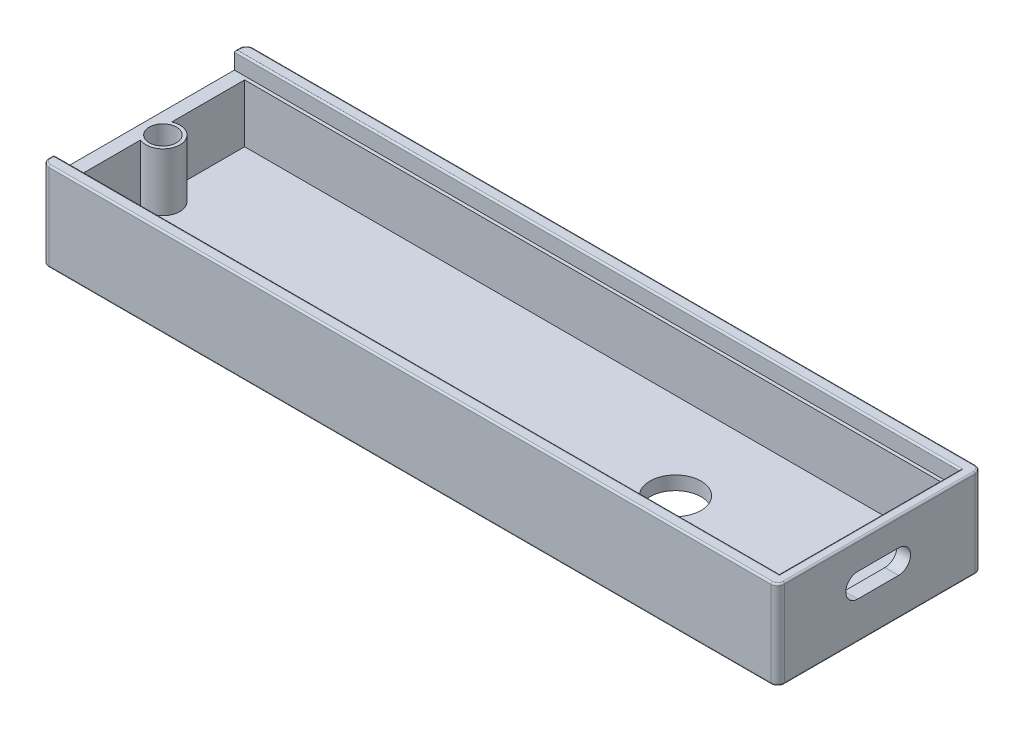
from build123d import *

# Parameters (mm, degrees)
SKETCH1_W                      = 108
SKETCH1_H                      = 30
BOSS_EXTRUDE1_DEPTH            = 13
SKETCH2_W                      = 106.5
SKETCH2_H                      = 26.5
CUT_EXTRUDE1_DEPTH             = 2.5
SKETCH3_W                      = 104
SKETCH3_H                      = 25.5
CUT_EXTRUDE2_DEPTH             = 11
FILLET1_R                      = 0.25
FILLET2_R                      = 1
SKETCH4_R                      = 2.5
BOSS_EXTRUDE2_DEPTH            = 8.5
F_2_2_2_2_DIAMETER_HOLE1_D     = 2.2
F_2_2_2_2_DIAMETER_HOLE1_DEPTH = 7
F_2_2_2_2_DIAMETER_HOLE1_TIP   = 0.660946681
THREAD1_PITCH                  = 0.4
CUT_EXTRUDE3_REACH             = 114.841
SKETCH11_W                     = 26.5
SKETCH11_H                     = 1.125
CUT_EXTRUDE4_DEPTH             = 1
SKETCH13_R                     = 3.75
CUT_EXTRUDE5_DEPTH             = 113.627705322
SKETCH18_R                     = 2
CUT_EXTRUDE7_DEPTH             = 4


with BuildPart() as part:
    # Sketch1 → Boss-Extrude1 (new body)
    with BuildSketch(Plane(origin=(0, 0, 0), x_dir=(1, 0, 0), z_dir=(0, 1, 0))):
        with Locations((54, -15)):
            Rectangle(SKETCH1_W, SKETCH1_H)
    extrude(amount=-BOSS_EXTRUDE1_DEPTH)

    # Sketch2 → Cut-Extrude1 (cut)
    with BuildSketch(Plane(origin=(0, 0, 0), x_dir=(1, 0, 0), z_dir=(0, 1, 0))):
        with Locations((53.25, -15)):
            Rectangle(SKETCH2_W, SKETCH2_H)
    extrude(amount=-CUT_EXTRUDE1_DEPTH, mode=Mode.SUBTRACT)

    # Sketch3 → Cut-Extrude2 (cut)
    with BuildSketch(Plane(origin=(0, 0, 0), x_dir=(1, 0, 0), z_dir=(0, 1, 0))):
        with Locations((54, -15)):
            Rectangle(SKETCH3_W, SKETCH3_H)
    extrude(amount=-CUT_EXTRUDE2_DEPTH, mode=Mode.SUBTRACT)

    # Fillet1
    fillet1_edges = [part.edges().sort_by_distance(p)[0] for p in [
        (108, -13, 15),
        (0, 0, 29.125),
        (54, -13, 0),
        (53.25, 0, 28.25),
        (106.5, 0, 15),
        (53.25, 0, 1.75),
        (0, -13, 15),
        (54, 0, 0),
        (108, 0, 15),
        (54, 0, 30),
        (0, 0, 0.875),
        (54, -13, 30),
    ]]
    fillet(fillet1_edges, radius=FILLET1_R)

    # Fillet2
    # the kernel refuses this fillet: 1 mm, written as the material it takes off along each edge
    with BuildSketch(Plane(origin=(1, -13, 1), x_dir=(-1, 0, 0), z_dir=(0, 0, 1))) as fillet2_piece_1:
        with BuildLine():
            CenterArc((0.75, -0.25), 0.25, 0, 90)
            Line((1, -0.25), (1, 0))
            Line((1, 0), (0.75, 0))
        make_face()
    revolve(axis=Axis((1, -13, 1), (0, -1, 0)), revolution_arc=90, mode=Mode.SUBTRACT)
    with BuildSketch(Plane(origin=(107, -13, 1), x_dir=(0, 0, -1), z_dir=(-1, 0, 0))) as fillet2_piece_2:
        with BuildLine():
            CenterArc((0.75, -0.25), 0.25, 0, 90)
            Line((1, -0.25), (1, 0))
            Line((1, 0), (0.75, 0))
        make_face()
    revolve(axis=Axis((107, -13, 1), (0, -1, 0)), revolution_arc=90, mode=Mode.SUBTRACT)
    with BuildSketch(Plane(origin=(1, -13, 29), x_dir=(0, 0, 1), z_dir=(1, 0, 0))) as fillet2_piece_3:
        with BuildLine():
            CenterArc((0.75, -0.25), 0.25, 0, 90)
            Line((1, -0.25), (1, 0))
            Line((1, 0), (0.75, 0))
        make_face()
    revolve(axis=Axis((1, -13, 29), (0, -1, 0)), revolution_arc=90, mode=Mode.SUBTRACT)
    with BuildSketch(Plane(origin=(107, -13, 29), x_dir=(1, 0, 0), z_dir=(0, 0, -1))) as fillet2_piece_4:
        with BuildLine():
            CenterArc((0.75, -0.25), 0.25, 0, 90)
            Line((1, -0.25), (1, 0))
            Line((1, 0), (0.75, 0))
        make_face()
    revolve(axis=Axis((107, -13, 29), (0, -1, 0)), revolution_arc=90, mode=Mode.SUBTRACT)
    with BuildSketch(Plane(origin=(1, 0, 29), x_dir=(-1, 0, 0), z_dir=(0, 0, -1))) as fillet2_piece_5:
        with BuildLine():
            CenterArc((0.75, -0.25), 0.25, 0, 90)
            Line((1, -0.25), (1, 0))
            Line((1, 0), (0.75, 0))
        make_face()
    revolve(axis=Axis((1, 0, 29), (0, 1, 0)), revolution_arc=90, mode=Mode.SUBTRACT)
    with BuildSketch(Plane(origin=(107, 0, 29), x_dir=(0, 0, 1), z_dir=(-1, 0, 0))) as fillet2_piece_6:
        with BuildLine():
            CenterArc((0.75, -0.25), 0.25, 0, 90)
            Line((1, -0.25), (1, 0))
            Line((1, 0), (0.75, 0))
        make_face()
    revolve(axis=Axis((107, 0, 29), (0, 1, 0)), revolution_arc=90, mode=Mode.SUBTRACT)
    with BuildSketch(Plane(origin=(107, 0, 1), x_dir=(1, 0, 0), z_dir=(0, 0, 1))) as fillet2_piece_7:
        with BuildLine():
            CenterArc((0.75, -0.25), 0.25, 0, 90)
            Line((1, -0.25), (1, 0))
            Line((1, 0), (0.75, 0))
        make_face()
    revolve(axis=Axis((107, 0, 1), (0, 1, 0)), revolution_arc=90, mode=Mode.SUBTRACT)
    with BuildSketch(Plane(origin=(1, 0, 1), x_dir=(0, 0, -1), z_dir=(1, 0, 0))) as fillet2_piece_8:
        with BuildLine():
            CenterArc((0.75, -0.25), 0.25, 0, 90)
            Line((1, -0.25), (1, 0))
            Line((1, 0), (0.75, 0))
        make_face()
    revolve(axis=Axis((1, 0, 1), (0, 1, 0)), revolution_arc=90, mode=Mode.SUBTRACT)
    with BuildSketch(Plane(origin=(0, 0, 30), x_dir=(0, 0, -1), z_dir=(0, -1, 0)), Plane(origin=(0, 0, 0), x_dir=(1, 0, 0), z_dir=(0, -1, 0))) as fillet2_piece_9:
        with BuildLine():
            CenterArc((FILLET2_R, FILLET2_R), FILLET2_R, 180, 90)
            Line((0, FILLET2_R), (0, 0))
            Line((0, 0), (FILLET2_R, 0))
        make_face()
    extrude(amount=13, mode=Mode.SUBTRACT)
    with BuildSketch(Plane(origin=(108, 0, 30), x_dir=(0, 0, -1), z_dir=(0, -1, 0)), Plane(origin=(108, 0, 0), x_dir=(-1, 0, 0), z_dir=(0, -1, 0))) as fillet2_piece_10:
        with BuildLine():
            CenterArc((FILLET2_R, -FILLET2_R), FILLET2_R, 90, 90)
            Line((0, -FILLET2_R), (0, 0))
            Line((0, 0), (FILLET2_R, 0))
        make_face()
    extrude(amount=13, mode=Mode.SUBTRACT)

    # Sketch4 → Boss-Extrude2 (add)
    with BuildSketch(Plane(origin=(0, -11, 0), x_dir=(1, 0, 0), z_dir=(0, 1, 0))):
        with Locations((3, -15.25)):
            Circle(SKETCH4_R)
    extrude(amount=BOSS_EXTRUDE2_DEPTH)

    # Ø2.2 (2.2) Diameter Hole1
    with Locations(Plane(origin=(3, -2.5, 15.25), x_dir=(0, 0, 1), z_dir=(0, 1, 0))):
        with Locations((0, 0)):
            Hole(F_2_2_2_2_DIAMETER_HOLE1_D / 2, depth=F_2_2_2_2_DIAMETER_HOLE1_DEPTH)
            with Locations((0, 0, -(F_2_2_2_2_DIAMETER_HOLE1_DEPTH + F_2_2_2_2_DIAMETER_HOLE1_TIP / 2))):  # 118° drill point
                Cone(0, F_2_2_2_2_DIAMETER_HOLE1_D / 2, F_2_2_2_2_DIAMETER_HOLE1_TIP, mode=Mode.SUBTRACT)

    # Thread1: the profile of Thread Profile1 profile screwed along a right-hand helix of 10 turns, 6 arcs to a turn; built about Z, then put on its axis
    thread1_z = Axis((0, 0, 0), (0, 0, 1))
    thread1_corners = [(1.0997, 0, -0.000173205), (1.31650635, 0, 0.124999999), (1.31650635, 0, 0.174999999), (1.0997, 0, 0.300173204)]
    with BuildLine(mode=Mode.PRIVATE) as thread1_profile:
        Line(thread1_corners[0], thread1_corners[1])
        Line(thread1_corners[1], thread1_corners[2])
        Line(thread1_corners[2], thread1_corners[3])
        Line(thread1_corners[3], thread1_corners[0])
    thread1_cap = Face(thread1_profile.wire())
    thread1_turn_angles = [0, 30, 60, 90, 120, 150, 180, 210, 240, 270, 300, 330, 360]
    thread1_turn_weights = [1, 0.8660254037844387, 1, 0.8660254037844387, 1, 0.8660254037844387, 1, 0.8660254037844387, 1, 0.8660254037844387, 1, 0.8660254037844387, 1]
    thread1_turn_rails = [Edge.make_bspline([Vector(p[0], p[1], 0).rotate(thread1_z, thread1_turn_angles[k]) / thread1_turn_weights[k] + Vector(0, 0, p[2] + THREAD1_PITCH * thread1_turn_angles[k] / 360) for k in range(13)], [0, 0, 0, 1, 1, 2, 2, 3, 3, 4, 4, 5, 5, 6, 6, 6], 2, thread1_turn_weights) for p in thread1_corners]
    thread1_turn_sides = [Face.make_surface_from_curves(thread1_turn_rails[p[0]], thread1_turn_rails[p[1]]) for p in [(0, 1), (1, 2), (2, 3), (3, 0)]]
    thread1 = Plane(origin=(3, -2.5, 15.25), x_dir=(-1, 0, 0), z_dir=(0, -1, 0)) * Solid(Shell([*[p.moved(Location((0, 0, THREAD1_PITCH * i))) for i in range(10) for p in thread1_turn_sides], thread1_cap, thread1_cap.rotate(thread1_z, 3600).moved(Location((0, 0, THREAD1_PITCH * 3600 / 360)))]))
    add(thread1, mode=Mode.SUBTRACT)

    # Sketch9 → Cut-Extrude3 (cut, up to next)
    with BuildSketch(Plane(origin=(108, 0, 0), x_dir=(0, 0, -1), z_dir=(1, 0, 0)), mode=Mode.PRIVATE) as cut_extrude3_sk1:
        with BuildLine():
            Line((-18.25, -4), (-12.25, -4))
            ThreePointArc((-12.25, -4), (-10.5, -5.75), (-12.25, -7.5))
            Line((-12.25, -7.5), (-18.25, -7.5))
            ThreePointArc((-18.25, -7.5), (-20, -5.75), (-18.25, -4))
        make_face()
    cut_extrude3_tool1 = extrude(cut_extrude3_sk1.sketch, amount=-CUT_EXTRUDE3_REACH, mode=Mode.PRIVATE) & part.part
    add(cut_extrude3_tool1.solids().sort_by_distance((108, -5.75, 15.25))[0], mode=Mode.SUBTRACT)

    # Sketch11 → Cut-Extrude4 (cut)
    with BuildSketch(Plane.ZY.offset(-106.5)):
        with Locations((15, -1.9375)):
            Rectangle(SKETCH11_W, SKETCH11_H)
    extrude(amount=-CUT_EXTRUDE4_DEPTH, mode=Mode.SUBTRACT)

    # Sketch13 → Cut-Extrude5 (cut, through all)
    with BuildSketch(Plane(origin=(0, -11, 0), x_dir=(1, 0, 0), z_dir=(0, 1, 0))):
        with Locations(Location((78, -15, 0), (0, 0, 270))):
            Circle(SKETCH13_R)
    extrude(amount=-CUT_EXTRUDE5_DEPTH, mode=Mode.SUBTRACT)

    # Sketch18 → Cut-Extrude7 (cut)
    with BuildSketch(Plane(origin=(0, -2.5, 0), x_dir=(1, 0, 0), z_dir=(0, 1, 0))):
        with Locations(Location((3, -15.25, 0), (0, 0, 270))):
            Circle(SKETCH18_R)
    extrude(amount=-CUT_EXTRUDE7_DEPTH, mode=Mode.SUBTRACT)


solid = part.part
